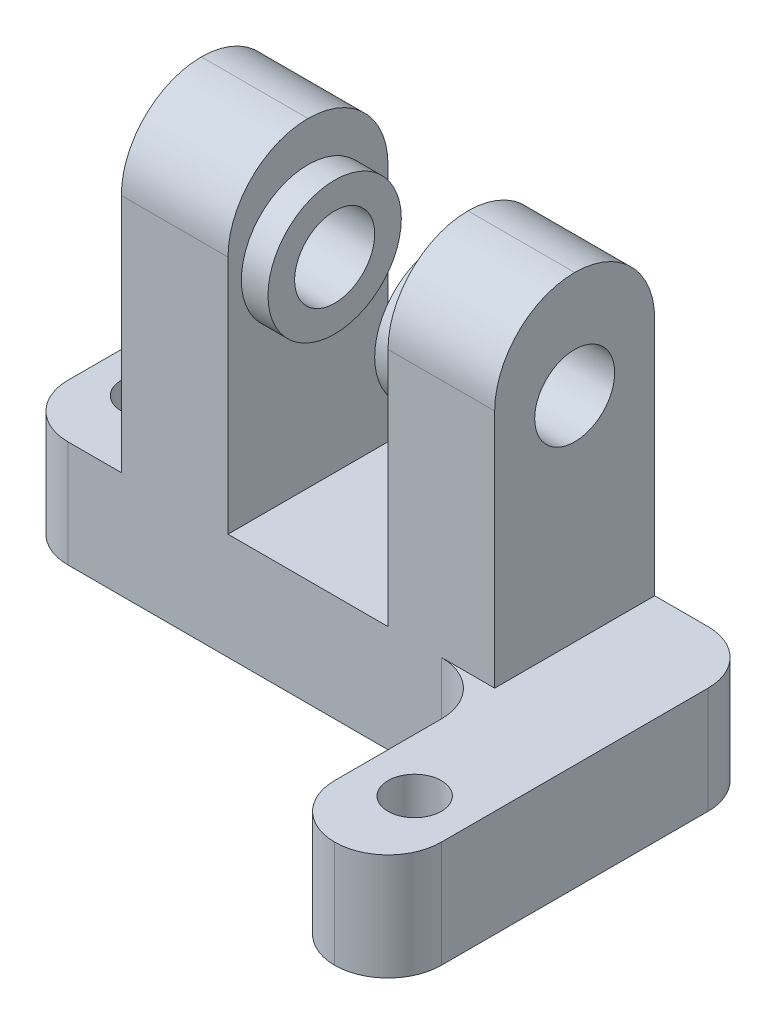
from build123d import *
from build123d.topology import SkipClean

# Parameters (mm, degrees)
SKETCH2_W               = 14
SKETCH2_H               = 6
BOSS_EXTRUDE1_DEPTH     = 4
SKETCH3_W               = 4
SKETCH3_H               = 6
BOSS_EXTRUDE2_DEPTH     = 12
CUT_EXTRUDE1_DEPTH      = 22.470910554
CUT_EXTRUDE1_DEPTH_BACK = 22.470910554
SKETCH4_R               = 1.5
BOSS_EXTRUDE3_START     = 1
SKETCH5_R               = 2.5
SKETCH5_R_2             = 1.5
BOSS_EXTRUDE3_DEPTH     = 1
SKETCH6_R               = 2.5
SKETCH6_R_2             = 1.5
BOSS_EXTRUDE4_DEPTH     = 1
SKETCH7_R               = 1
SKETCH7_W               = 4
SKETCH7_H               = 6
BOSS_EXTRUDE5_DEPTH     = 4
FILLET1_R               = 2
FILLET2_R               = 3


with BuildPart() as part:
    # Sketch2 → Boss-Extrude1 (new body)
    with BuildSketch(Plane(origin=(0, 0, 0), x_dir=(1, 0, 0), z_dir=(0, 1, 0))):
        Rectangle(SKETCH2_W, SKETCH2_H)
    extrude(amount=BOSS_EXTRUDE1_DEPTH)

    # Sketch3 → Boss-Extrude2 (add)
    with BuildSketch(Plane(origin=(0, 4, 0), x_dir=(1, 0, 0), z_dir=(0, 1, 0))):
        with Locations((-5, 0)):
            Rectangle(SKETCH3_W, SKETCH3_H)
        with Locations((5, 0)):
            Rectangle(SKETCH3_W, SKETCH3_H)
    extrude(amount=BOSS_EXTRUDE2_DEPTH)

    # Sketch4 → Cut-Extrude1 (cut, two sides: drawn at the far end of the back side and taken through both)
    with BuildSketch(Plane(origin=(7, 0, 0), x_dir=(0, 0, -1), z_dir=(1, 0, 0)).offset(-CUT_EXTRUDE1_DEPTH_BACK)):
        with Locations((0, 12)):
            Circle(SKETCH4_R)
    extrude(amount=CUT_EXTRUDE1_DEPTH + CUT_EXTRUDE1_DEPTH_BACK, mode=Mode.SUBTRACT)

    # Sketch5 → Boss-Extrude3 (add)
    with BuildSketch(Plane(origin=(-3, 0, 0), x_dir=(0, 0, -1), z_dir=(1, 0, 0)).offset(BOSS_EXTRUDE3_START)):
        with Locations(Location((0, 12, 0), (0, 0, 180))):
            Circle(SKETCH5_R)
        with Locations((0, 12)):
            Circle(SKETCH5_R_2, mode=Mode.SUBTRACT)
    extrude(amount=-BOSS_EXTRUDE3_DEPTH)

    # Sketch6 → Boss-Extrude4 (add)
    with SkipClean():  # the faces are left unmerged after this step: merging them gives an invalid solid
        with BuildSketch(Plane.ZY.offset(-3)):
            with Locations((0, 12)):
                Circle(SKETCH6_R)
            with Locations((0, 12)):
                Circle(SKETCH6_R_2, mode=Mode.SUBTRACT)
        extrude(amount=BOSS_EXTRUDE4_DEPTH)

    # Sketch7 → Boss-Extrude5 (add)
    # profile 1 of 2: a face of its own
    with SkipClean():  # the faces are left unmerged after this step: merging them gives an invalid solid
        with BuildSketch(Plane(origin=(0, 4, 0), x_dir=(1, 0, 0), z_dir=(0, 1, 0))):
            Polygon((11, 3), (11, -3), (11, -11), (7, -11), (7, -3), (7, 3), align=None)
            with Locations(Location((9, -8, 0), (0, 0, 270))):
                Circle(SKETCH7_R, mode=Mode.SUBTRACT)
        # profile 2 of 2: a face of its own
        with BuildSketch(Plane(origin=(0, 4, 0), x_dir=(1, 0, 0), z_dir=(0, 1, 0))):
            with Locations((-9, 0)):
                Rectangle(SKETCH7_W, SKETCH7_H)
            with Locations(Location((-9, 0, 0), (0, 0, 270))):
                Circle(SKETCH7_R, mode=Mode.SUBTRACT)
        extrude(amount=-BOSS_EXTRUDE5_DEPTH)

    # Fillet1
    fillet1_edges = [part.edges().sort_by_distance(p)[0] for p in [
        (-11, 2, -3),
        (11, 2, -3),
        (11, 2, 11),
        (7, 2, 11),
        (-11, 2, 3),
        (7, 2, 3),
    ]]
    fillet(fillet1_edges, radius=FILLET1_R - 0.0001)  # a hair under: the kernel refuses the full size

    # Fillet2
    fillet2_edges = [part.edges().sort_by_distance(p)[0] for p in [
        (-5, 16, -3),
        (5, 16, -3),
        (5, 16, 3),
        (-5, 16, 3),
    ]]
    fillet(fillet2_edges, radius=FILLET2_R - 0.0001)  # a hair under: the kernel refuses the full size


solid = part.part
